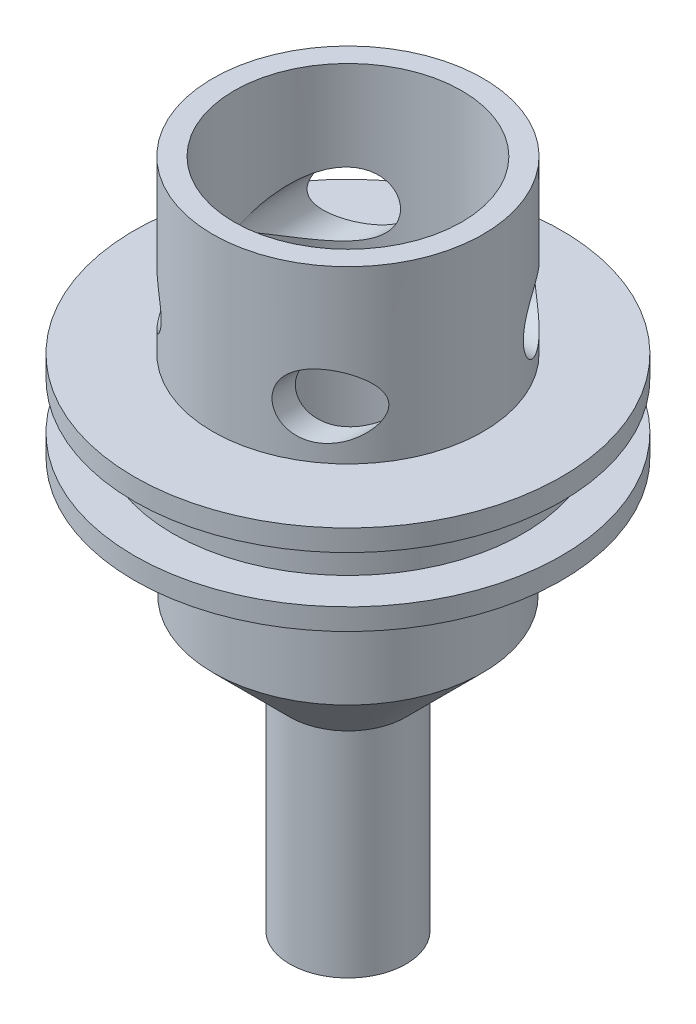
from build123d import *

# Parameters (mm, degrees)
SKETCH2_R                = 12.7
SOLID_CYLINDER_DEPTH     = 39.878
ALL_THROUGH_HOLE_REACH   = 45.736
SKETCH3_R                = 1.7272
SKETCH4_R                = 6.7691
SWIRL_CHAMBER_DEPTH      = 19.05
TOP_START                = -10.16
SKETCH5_R                = 12.7
SKETCH5_R_2              = 8.0391
TOP_OUTER_CUT_DEPTH      = 10.16
SKETCH8_W                = 2.286
SKETCH8_H                = 2.794
SKETCH9_W                = 4.699
SKETCH9_H                = 24.384
INNER_CHAMFER_SIZE       = 5.08
INLET_HOLE_REACH         = 45.736
INLET_HOLE_END_RADIUS    = 8.0391
SKETCH12_R               = 1.905
INLET_HOLE_PATTERN_COUNT = 4


with BuildPart() as part:
    # Sketch2 → Solid Cylinder (new body)
    with BuildSketch(Plane(origin=(0, 0, 0), x_dir=(1, 0, 0), z_dir=(0, 1, 0))):
        with Locations(Location((0, 0, 0), (0, 0, 270))):
            Circle(SKETCH2_R)
    extrude(amount=SOLID_CYLINDER_DEPTH)

    # Sketch3 → All Through Hole (cut, up to next)
    with BuildSketch(Plane(origin=(0, 39.878, 0), x_dir=(1, 0, 0), z_dir=(0, 1, 0)), mode=Mode.PRIVATE) as all_through_hole_sk1:
        with Locations(Location((0, 0, 0), (0, 0, 270))):
            Circle(SKETCH3_R)
    all_through_hole_tool1 = extrude(all_through_hole_sk1.sketch, amount=-ALL_THROUGH_HOLE_REACH, mode=Mode.PRIVATE) & part.part
    add(all_through_hole_tool1.solids().sort_by_distance((0, 39.878, 0))[0], mode=Mode.SUBTRACT)

    # Sketch4 → Swirl Chamber (cut)
    with BuildSketch(Plane(origin=(0, 39.878, 0), x_dir=(1, 0, 0), z_dir=(0, 1, 0))):
        with Locations(Location((0, 0, 0), (0, 0, 270))):
            Circle(SKETCH4_R)
    extrude(amount=-SWIRL_CHAMBER_DEPTH, mode=Mode.SUBTRACT)

    # Sketch5 → Top Outer cut (cut)
    with BuildSketch(Plane(origin=(0, 39.878, 0), x_dir=(1, 0, 0), z_dir=(0, 1, 0)).offset(TOP_START)):
        with Locations(Location((0, 0, 0), (0, 0, 270))):
            Circle(SKETCH5_R)
        with Locations(Location((0, 0, 0), (0, 0, 270))):
            Circle(SKETCH5_R_2, mode=Mode.SUBTRACT)
    extrude(amount=TOP_OUTER_CUT_DEPTH, mode=Mode.SUBTRACT)

    # Sketch8 → O Ring Cut (revolve, cut)
    with BuildSketch(Plane.XY, mode=Mode.PRIVATE) as o_ring_cut_sk:
        with Locations((11.557, 27.051)):
            Rectangle(SKETCH8_W, SKETCH8_H)
    revolve(o_ring_cut_sk.sketch.rotate(Axis((0, 55, 0), (0, -1, 0)), 90), axis=Axis((0, 55, 0), (0, -1, 0)), mode=Mode.SUBTRACT)

    # Sketch9 → Base Support (revolve, cut)
    with BuildSketch(Plane.XY, mode=Mode.PRIVATE) as base_support_sk:
        with Locations((10.3505, 12.192)):
            Rectangle(SKETCH9_W, SKETCH9_H)
    revolve(base_support_sk.sketch.rotate(Axis((0, 55, 0), (0, -1, 0)), 90), axis=Axis((0, 55, 0), (0, -1, 0)), mode=Mode.SUBTRACT)

    # Inner Chamfer
    # the kernel refuses this chamfer: 5.08 mm, written as the material it takes off along each edge
    with BuildSketch(Plane(origin=(0, 20.828, 0), x_dir=(0, 0, 1), z_dir=(-1, 0, 0))) as inner_chamfer_piece_1_section:
        Polygon((1.7272, -INNER_CHAMFER_SIZE), (1.7272 + INNER_CHAMFER_SIZE, 0), (1.7272, 0), align=None)
    inner_chamfer_piece_1 = revolve(axis=Axis((0, 20.828, 0), (0, 1, 0)), mode=Mode.PRIVATE)
    inner_chamfer_piece_1 = inner_chamfer_piece_1 & Plane(origin=(0, 18.244555095, 0), x_dir=(0, 0, 1), z_dir=(0, 1, 0)) * Cylinder(6.7691, 28, mode=Mode.PRIVATE)
    add(inner_chamfer_piece_1, mode=Mode.SUBTRACT)

    # Inlet Hole: up to this cylinder (the profile starts inside it)
    inlet_hole_end = Plane(origin=(0, 32.639, 0), z_dir=(0, 1, 0)) * Cylinder(INLET_HOLE_END_RADIUS, 108.5502, mode=Mode.PRIVATE)
    # Sketch12 → Inlet Hole (cut, up to the surface)
    with BuildSketch(Plane.XY, mode=Mode.PRIVATE) as inlet_hole_sk1:
        with Locations(Location((4.8641, 32.639, 0), (0, 0, 180))):
            Circle(SKETCH12_R)
    inlet_hole_tool1 = extrude(inlet_hole_sk1.sketch, amount=INLET_HOLE_REACH, mode=Mode.PRIVATE) & inlet_hole_end
    inlet_hole = inlet_hole_tool1.solids().sort_by_distance((4.8641, 32.639, 0))[0]
    add(inlet_hole, mode=Mode.SUBTRACT)

    # Inlet Hole Pattern: Inlet Hole ×4 about axis
    inlet_hole_pattern_axis = Axis((0, 55, 0), (0, -1, 0))
    for i in range(1, INLET_HOLE_PATTERN_COUNT):
        add(inlet_hole.rotate(inlet_hole_pattern_axis, i * 360 / INLET_HOLE_PATTERN_COUNT), mode=Mode.SUBTRACT)

    # Sketch13 → Outer Chamfer and Stem (revolve, cut)
    with BuildSketch(Plane.XY, mode=Mode.PRIVATE) as outer_chamfer_and_stem_sk:
        Polygon((-8.001, 17.272), (-3.4544, 12.7254), (-3.4544, 0), (-8.001, 0), align=None)
    revolve(outer_chamfer_and_stem_sk.sketch.rotate(Axis((0, 46.59080533, 0), (0, -1, 0)), 270), axis=Axis((0, 46.59080533, 0), (0, -1, 0)), mode=Mode.SUBTRACT)


solid = part.part
